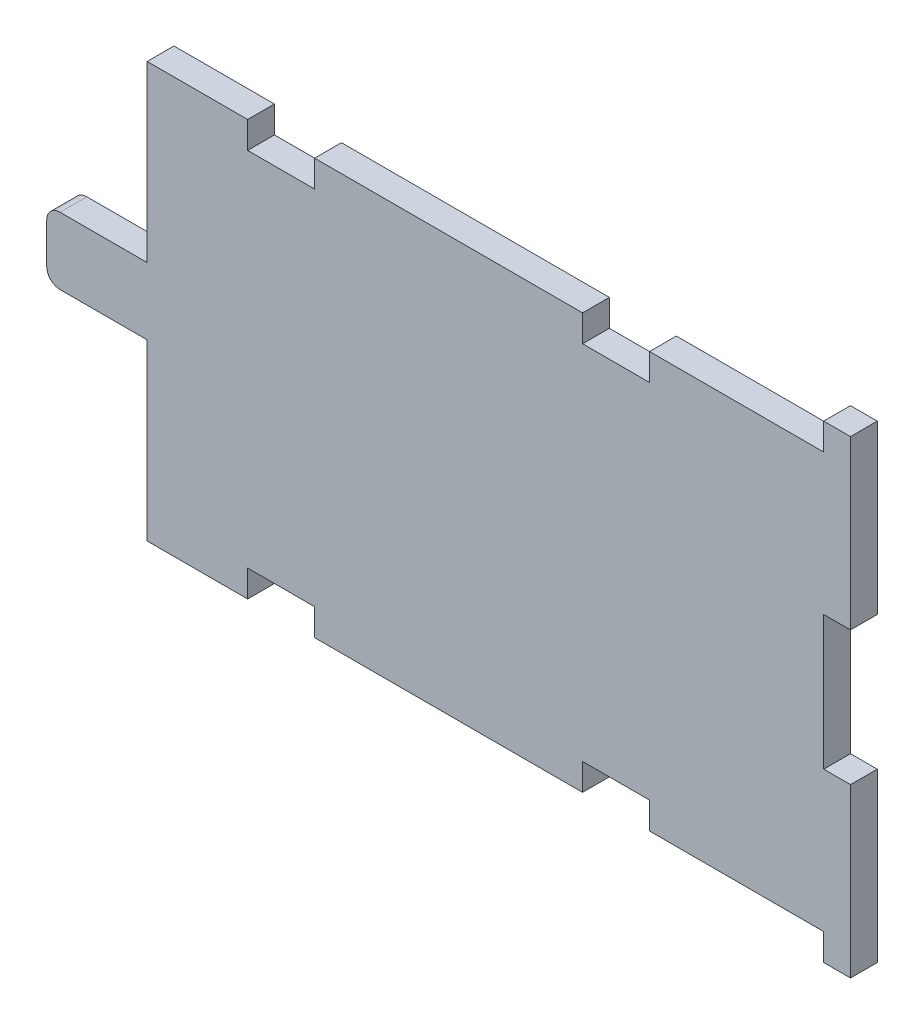
from build123d import *

# Parameters (mm, degrees)
BOSS_EXTRUDE1_DEPTH = 4
SKETCH2_W           = 4
SKETCH2_H           = 20
CUT_EXTRUDE1_DEPTH  = 4
SKETCH3_W           = 15
SKETCH3_H           = 10
BOSS_EXTRUDE2_DEPTH = 4
FILLET1_R           = 2
SKETCH4_W           = 10
SKETCH4_H           = 4
CUT_EXTRUDE2_DEPTH  = 4


with BuildPart() as part:
    # Sketch1 → Boss-Extrude1 (new body)
    with BuildSketch(Plane.XY):
        Polygon((0, 0), (101, 0), (101, -4), (105, -4), (105, 0), (105, 62), (105, 66), (101, 66), (101, 62), (0, 62), align=None)
    extrude(amount=BOSS_EXTRUDE1_DEPTH)

    # Sketch2 → Cut-Extrude1 (cut)
    with BuildSketch(Plane.XY.offset(4)):
        with Locations((103, 31)):
            Rectangle(SKETCH2_W, SKETCH2_H)
    extrude(amount=-CUT_EXTRUDE1_DEPTH, mode=Mode.SUBTRACT)

    # Sketch3 → Boss-Extrude2 (add)
    with BuildSketch(Plane.XY.offset(4)):
        with Locations((-7.5, 31)):
            Rectangle(SKETCH3_W, SKETCH3_H)
    extrude(amount=-BOSS_EXTRUDE2_DEPTH)

    # Fillet1
    fillet1_edges = [part.edges().sort_by_distance(p)[0] for p in [
        (-15, 36, 2),
        (-15, 26, 2),
    ]]
    fillet(fillet1_edges, radius=FILLET1_R)

    # Sketch4 → Cut-Extrude2 (cut)
    with BuildSketch(Plane.XY.offset(4)):
        with Locations((20, 2)):
            Rectangle(SKETCH4_W, SKETCH4_H)
        with Locations((70, 2)):
            Rectangle(SKETCH4_W, SKETCH4_H)
        with Locations((70, 60)):
            Rectangle(SKETCH4_W, SKETCH4_H)
        with Locations((20, 60)):
            Rectangle(SKETCH4_W, SKETCH4_H)
    extrude(amount=-CUT_EXTRUDE2_DEPTH, mode=Mode.SUBTRACT)


solid = part.part
